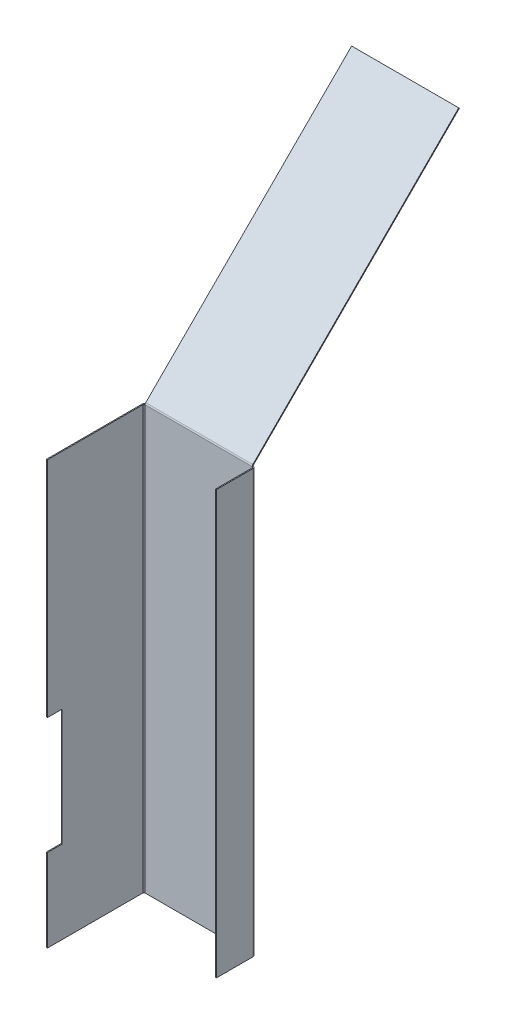
from build123d import *

# Parameters (mm, degrees)
BASE_FLANGE1_DEPTH = 69.85
EDGE_FLANGE1_DEPTH = 275.783864678
EDGE_FLANGE2_DEPTH = 275.783864678
CUT_EXTRUDE1_REACH = 440.752
SKETCH12_W         = 9.573642834
SKETCH12_H         = 76.2


# Sheet-metal steps are written as plain solids
with BuildPart() as part:
    # Sketch1 → Base-Flange1 (new body)
    with BuildSketch(Plane(origin=(0, 0, 0), x_dir=(0, 0, -1), z_dir=(1, 0, 0))):
        with BuildLine():
            Line((0, 0), (0, 275.783864678))
            ThreePointArc((0, 275.783864678), (0.104406833, 276.308753274), (0.401732339, 276.753732339))
            Line((0.401732339, 276.753732339), (134.703841816, 411.055841816))
            Line((134.703841816, 411.055841816), (135.152854622, 410.60682901))
            Line((135.152854622, 410.60682901), (0.850745145, 276.304719533))
            ThreePointArc((0.850745145, 276.304719533), (0.691070336, 276.065749294), (0.635, 275.783864678))
            Line((0.635, 275.783864678), (0.635, 0))
            Line((0.635, 0), (0, 0))
        make_face()
    extrude(amount=BASE_FLANGE1_DEPTH)

    # Edge-Flange1 section (across the edge) → Edge-Flange1 (add)
    with BuildSketch(Plane(origin=(-0.7366, 275.783864678, 0), x_dir=(1, 0, 0), z_dir=(0, -1, 0))):
        with BuildLine():
            Line((-0.635, 0.7366), (-0.635, 62.865))
            Line((-0.635, 62.865), (0, 62.865))
            Line((0, 62.865), (0, 0.7366))
            ThreePointArc((0, 0.7366), (0.215745145, 0.215745145), (0.7366, 0))
            Line((0.7366, 0), (0.7366, -0.635))
            ThreePointArc((0.7366, -0.635), (-0.233267661, -0.233267661), (-0.635, 0.7366))
        make_face()
    extrude(amount=EDGE_FLANGE1_DEPTH)

    # Edge-Flange2 section (across the edge) → Edge-Flange2 (add)
    with BuildSketch(Plane(origin=(70.5866, 0, 0), x_dir=(-1, 0, 0), z_dir=(0, 1, 0))):
        with BuildLine():
            Line((-0.635, 0.7366), (-0.635, 24.765))
            Line((-0.635, 24.765), (0, 24.765))
            Line((0, 24.765), (0, 0.7366))
            ThreePointArc((0, 0.7366), (0.215745145, 0.215745145), (0.7366, 0))
            Line((0.7366, 0), (0.7366, -0.635))
            ThreePointArc((0.7366, -0.635), (-0.233267661, -0.233267661), (-0.635, 0.7366))
        make_face()
    extrude(amount=EDGE_FLANGE2_DEPTH)

    # Sketch12 → Cut-Extrude1 (cut, up to next)
    with BuildSketch(Plane.ZY.offset(1.3716), mode=Mode.PRIVATE) as cut_extrude1_sk1:
        with Locations((58.078178583, 92.075)):
            Rectangle(SKETCH12_W, SKETCH12_H)
    cut_extrude1_tool1 = extrude(cut_extrude1_sk1.sketch, amount=-CUT_EXTRUDE1_REACH, mode=Mode.PRIVATE) & part.part
    add(cut_extrude1_tool1.solids().sort_by_distance((-1.3716, 92.075, 58.078179))[0], mode=Mode.SUBTRACT)


solid = part.part
